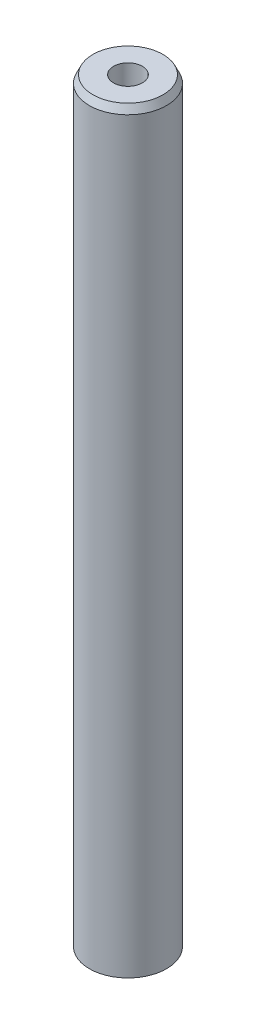
from build123d import *
from OCP.BRepFilletAPI import BRepFilletAPI_MakeChamfer

# Parameters (mm, degrees)
SKETCH1_R           = 5
BOSS_EXTRUDE1_DEPTH = 98.30099098
SKETCH2_R           = 1.86729965
CUT_EXTRUDE1_DEPTH  = 99.554983779
CHAMFER1_SIZE       = 0.978185993
CHAMFER1_SIZE2      = 0.46284886


with BuildPart() as part:
    # Sketch1 → Boss-Extrude1 (new body)
    with BuildSketch(Plane(origin=(0, 0, 0), x_dir=(1, 0, 0), z_dir=(0, 1, 0))):
        Circle(SKETCH1_R)
    extrude(amount=BOSS_EXTRUDE1_DEPTH)

    # Sketch2 → Cut-Extrude1 (cut, through all)
    with BuildSketch(Plane(origin=(0, 0, 0), x_dir=(1, 0, 0), z_dir=(0, 1, 0))):
        Circle(SKETCH2_R)
    extrude(amount=CUT_EXTRUDE1_DEPTH, mode=Mode.SUBTRACT)

    # Chamfer1: one chamfer whose edges measure the first distance from different faces: ONE call of the kernel's chamfer builder (chamfer() names one face for all edges)
    chamfer1_edges_1 = [part.edges().sort_by_distance(p)[0] for p in [
        (-5, 98.30099098, 0),
    ]]
    chamfer1_side_1 = [part.faces().sort_by_distance(p)[0] for p in [
        (-5, 49.15049549, 0),
    ]]
    chamfer1_edges_2 = [part.edges().sort_by_distance(p)[0] for p in [
        (-5, 0, 0),
    ]]
    chamfer1_side_2 = [part.faces().sort_by_distance(p)[0] for p in [
        (-4.858578644, 0, 0),
    ]]
    chamfer1 = BRepFilletAPI_MakeChamfer(part.part.solid().wrapped)
    for e in chamfer1_edges_1:
        chamfer1.Add(CHAMFER1_SIZE, CHAMFER1_SIZE2, e.wrapped, chamfer1_side_1[0].wrapped)  # the first distance lies on this face
    for e in chamfer1_edges_2:
        chamfer1.Add(CHAMFER1_SIZE, CHAMFER1_SIZE2, e.wrapped, chamfer1_side_2[0].wrapped)  # the first distance lies on this face
    add(Compound.cast(chamfer1.Shape()), mode=Mode.REPLACE)


solid = part.part
